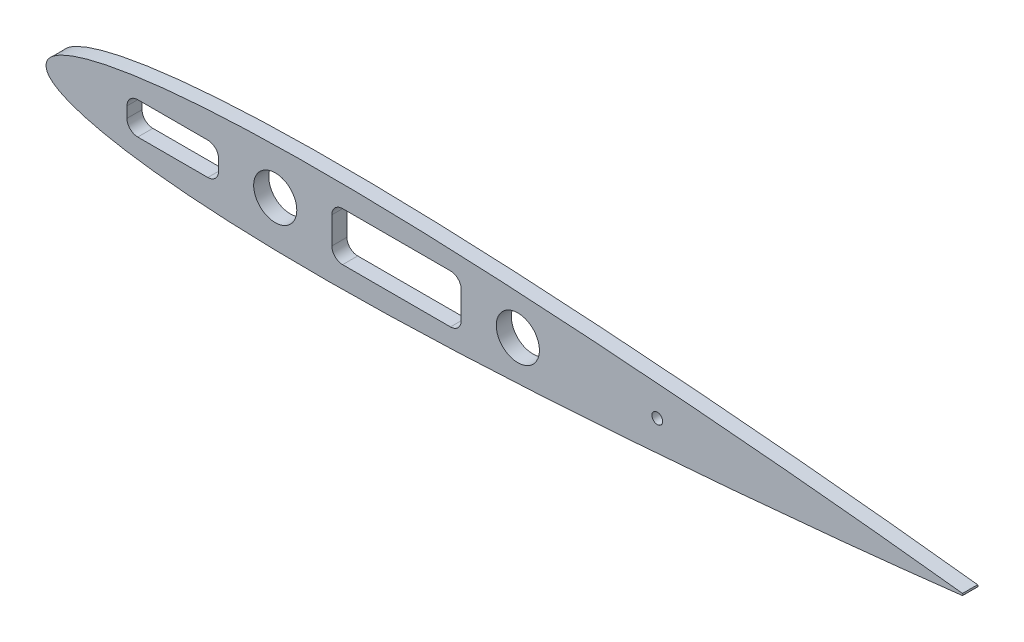
from build123d import *

# Parameters (mm, degrees)
SKETCH_1_R      = 1
SKETCH_1_R_2    = 4
EXTRUDE_1_DEPTH = 1.4


with BuildPart() as part:
    # Эскиз1 → Бобышка-Вытянуть1 (new, symmetric)
    with BuildSketch(Plane.XY):
        with BuildLine():
            add(Edge.make_bspline(
                [(110, 0), (110.027578176, -0.23672144), (110.085538218, -0.73423022), (110.530223642, -1.427069758), (111.196336341, -2.078555233), (112.109835923, -2.701306388), (113.256788366, -3.299309238), (114.63793972, -3.873060466), (116.247665798, -4.421392386), (118.081312133, -4.942567641), (120.133109351, -5.434797476), (122.397158974, -5.896120566), (124.867245825, -6.324666077), (127.536961089, -6.718650341), (130.399721686, -7.07642431), (133.448762895, -7.396480569), (136.677139412, -7.677604542), (140.077743555, -7.918678943), (143.643266298, -8.118975561), (147.366223919, -8.277985977), (151.238917925, -8.395506076), (155.253439756, -8.471528808), (159.401643404, -8.506522967), (163.675147454, -8.5010027), (168.065295924, -8.455953662), (172.563150272, -8.372486564), (177.159453511, -8.251957682), (181.844626933, -8.095958493), (186.608700127, -7.906218293), (191.441311474, -7.684604439), (196.331634567, -7.433105337), (201.268368917, -7.153826886), (206.239642946, -6.848873), (211.232977593, -6.52047435), (216.235178286, -6.170864577), (221.232257467, -5.802244475), (226.209311114, -5.416958265), (231.150377303, -5.017351103), (236.038226964, -4.605811749), (240.854179313, -4.184912649), (247.071089236, -3.62220531), (253.116111921, -3.047869044), (258.952644662, -2.467188138), (263.047743378, -2.047856604), (266.898988862, -1.642607304), (270.455833183, -1.258590905), (273.651166984, -0.905304265), (276.385426802, -0.596436482), (278.45259621, -0.358958361), (279.592043704, -0.226075898), (280, -0.1785)],
                knots=[0, 0, 0, 0, 0.004099011, 0.008614742, 0.013934855, 0.020277775, 0.027752981, 0.036410215, 0.046266433, 0.057320238, 0.069558946, 0.082962861, 0.097507218, 0.113164082, 0.12990269, 0.147690304, 0.166492185, 0.186271967, 0.206991861, 0.228612215, 0.251092165, 0.274388983, 0.298458209, 0.323253842, 0.348727971, 0.374830387, 0.40150919, 0.428710016, 0.456376154, 0.484448083, 0.512863887, 0.541558094, 0.570462313, 0.599504248, 0.628607349, 0.657690446, 0.686667237, 0.715444849, 0.743923546, 0.77199483, 0.799540253, 0.852512115, 0.877624446, 0.901571134, 0.924121062, 0.944988816, 0.963803939, 0.980044339, 0.992855276, 1, 1, 1, 1], degree=3))
            ThreePointArc((280, -0.1785), (280.073937121, 0), (280, 0.1785))
            add(Edge.make_bspline(
                [(280, 0.1785), (279.592043704, 0.226075898), (278.45259621, 0.358958361), (276.385426802, 0.596436482), (273.651166984, 0.905304265), (270.455833183, 1.258590905), (266.898988862, 1.642607304), (263.047743378, 2.047856604), (258.952644662, 2.467188138), (253.116111921, 3.047869044), (247.071089236, 3.62220531), (240.854179313, 4.184912649), (236.038226964, 4.605811749), (231.150377303, 5.017351103), (226.209311114, 5.416958265), (221.232257467, 5.802244475), (216.235178286, 6.170864577), (211.232977593, 6.52047435), (206.239642946, 6.848873), (201.268368917, 7.153826886), (196.331634567, 7.433105337), (191.441311474, 7.684604439), (186.608700127, 7.906218293), (181.844626933, 8.095958493), (177.159453511, 8.251957682), (172.563150272, 8.372486564), (168.065295924, 8.455953662), (163.675147454, 8.5010027), (159.401643404, 8.506522967), (155.253439756, 8.471528808), (151.238917925, 8.395506076), (147.366223919, 8.277985977), (143.643266298, 8.118975561), (140.077743555, 7.918678943), (136.677139412, 7.677604542), (133.448762895, 7.396480569), (130.399721686, 7.07642431), (127.536961089, 6.718650341), (124.867245825, 6.324666077), (122.397158974, 5.896120566), (120.133109351, 5.434797476), (118.081312133, 4.942567641), (116.247665798, 4.421392386), (114.63793972, 3.873060466), (113.256788366, 3.299309238), (112.109835923, 2.701306388), (111.196336341, 2.078555233), (110.530223642, 1.427069758), (110.085538218, 0.73423022), (110.027578176, 0.23672144), (110, 0)],
                knots=[0, 0, 0, 0, 0.007144724, 0.019955661, 0.036196061, 0.055011184, 0.075878938, 0.098428866, 0.122375554, 0.147487885, 0.200459747, 0.22800517, 0.256076454, 0.284555151, 0.313332763, 0.342309554, 0.371392651, 0.400495752, 0.429537687, 0.458441906, 0.487136113, 0.515551917, 0.543623846, 0.571289984, 0.59849081, 0.625169613, 0.651272029, 0.676746158, 0.701541791, 0.725611017, 0.748907835, 0.771387785, 0.793008139, 0.813728033, 0.833507815, 0.852309696, 0.87009731, 0.886835918, 0.902492782, 0.917037139, 0.930441054, 0.942679762, 0.953733567, 0.963589785, 0.972247019, 0.979722225, 0.986065145, 0.991385258, 0.995900989, 1, 1, 1, 1], degree=3))
        make_face()
        with Locations((223.382624747, 0)):
            Circle(SKETCH_1_R, mode=Mode.SUBTRACT)
        with Locations((197.51848428, 0)):
            Circle(SKETCH_1_R_2, mode=Mode.SUBTRACT)
        with BuildLine():
            Line((140.01848428, -3), (127.01848428, -3))
            ThreePointArc((127.01848428, -3), (125.604270718, -2.414213562), (125.01848428, -1))
            Line((125.01848428, -1), (125.01848428, 1))
            ThreePointArc((125.01848428, 1), (125.604270718, 2.414213562), (127.01848428, 3))
            Line((127.01848428, 3), (140.01848428, 3))
            ThreePointArc((140.01848428, 3), (141.432697843, 2.414213562), (142.01848428, 1))
            Line((142.01848428, 1), (142.01848428, -1))
            ThreePointArc((142.01848428, -1), (141.432697843, -2.414213562), (140.01848428, -3))
        make_face(mode=Mode.SUBTRACT)
        with Locations((152.51848428, 0)):
            Circle(SKETCH_1_R_2, mode=Mode.SUBTRACT)
        with BuildLine():
            Line((185.01848428, -4.5), (165.01848428, -4.5))
            ThreePointArc((165.01848428, -4.5), (163.604270718, -3.914213562), (163.01848428, -2.5))
            Line((163.01848428, -2.5), (163.01848428, 2.5))
            ThreePointArc((163.01848428, 2.5), (163.604270718, 3.914213562), (165.01848428, 4.5))
            Line((165.01848428, 4.5), (185.01848428, 4.5))
            ThreePointArc((185.01848428, 4.5), (186.432697843, 3.914213562), (187.01848428, 2.5))
            Line((187.01848428, 2.5), (187.01848428, -2.5))
            ThreePointArc((187.01848428, -2.5), (186.432697843, -3.914213562), (185.01848428, -4.5))
        make_face(mode=Mode.SUBTRACT)
    extrude(amount=EXTRUDE_1_DEPTH, both=True)


solid = part.part
